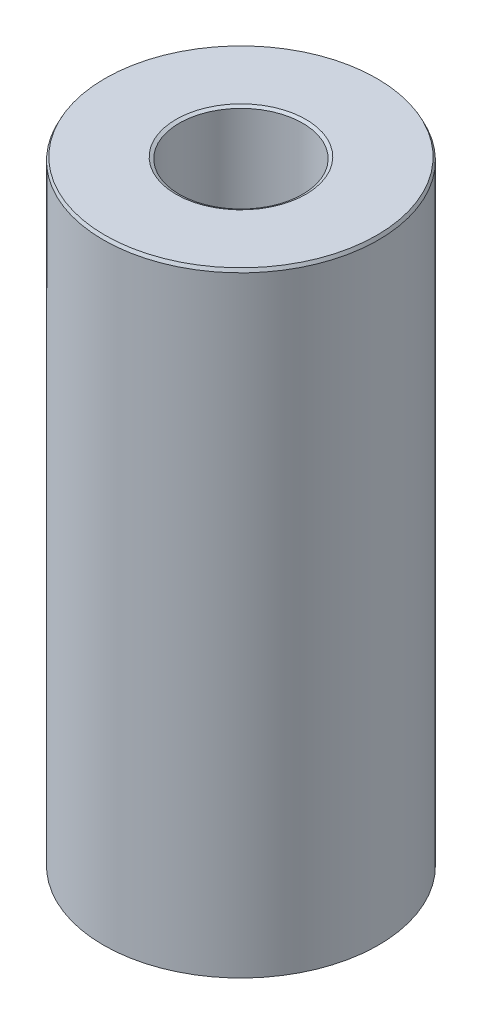
from build123d import *
from OCP.BRepFilletAPI import BRepFilletAPI_MakeChamfer

# Parameters (mm, degrees)
SKETCH1_R           = 12.5
BOSS_EXTRUDE1_DEPTH = 55.955032487
SKETCH2_R           = 5.6073632
CUT_EXTRUDE1_DEPTH  = 59.681050269
CHAMFER1_SIZE       = 0.295286317
CHAMFER1_SIZE2      = 0.147431193


with BuildPart() as part:
    # Sketch1 → Boss-Extrude1 (new body)
    with BuildSketch(Plane(origin=(0, 0, 0), x_dir=(1, 0, 0), z_dir=(0, 1, 0))):
        Circle(SKETCH1_R)
    extrude(amount=BOSS_EXTRUDE1_DEPTH)

    # Sketch2 → Cut-Extrude1 (cut, through all)
    with BuildSketch(Plane(origin=(0, 0, 0), x_dir=(1, 0, 0), z_dir=(0, 1, 0))):
        Circle(SKETCH2_R)
    extrude(amount=CUT_EXTRUDE1_DEPTH, mode=Mode.SUBTRACT)

    # Chamfer1: one chamfer whose edges measure the first distance from different faces: ONE call of the kernel's chamfer builder (chamfer() names one face for all edges)
    chamfer1_edges_1 = [part.edges().sort_by_distance(p)[0] for p in [
        (-5.6073632, 55.955032487, 0),
    ]]
    chamfer1_side_1 = [part.faces().sort_by_distance(p)[0] for p in [
        (-12.146446609, 55.955032487, 0),
    ]]
    chamfer1_edges_2 = [part.edges().sort_by_distance(p)[0] for p in [
        (-5.6073632, 0, 0),
    ]]
    chamfer1_side_2 = [part.faces().sort_by_distance(p)[0] for p in [
        (-5.6073632, 27.977516244, 0),
    ]]
    chamfer1_edges_3 = [part.edges().sort_by_distance(p)[0] for p in [
        (-12.5, 0, 0),
    ]]
    chamfer1_side_3 = [part.faces().sort_by_distance(p)[0] for p in [
        (-12.146446609, 0, 0),
    ]]
    chamfer1_edges_4 = [part.edges().sort_by_distance(p)[0] for p in [
        (-12.5, 55.955032487, 0),
    ]]
    chamfer1_side_4 = [part.faces().sort_by_distance(p)[0] for p in [
        (-12.5, 27.977516244, 0),
    ]]
    chamfer1 = BRepFilletAPI_MakeChamfer(part.part.solid().wrapped)
    for e in chamfer1_edges_1:
        chamfer1.Add(CHAMFER1_SIZE, CHAMFER1_SIZE2, e.wrapped, chamfer1_side_1[0].wrapped)  # the first distance lies on this face
    for e in chamfer1_edges_2:
        chamfer1.Add(CHAMFER1_SIZE, CHAMFER1_SIZE2, e.wrapped, chamfer1_side_2[0].wrapped)  # the first distance lies on this face
    for e in chamfer1_edges_3:
        chamfer1.Add(CHAMFER1_SIZE, CHAMFER1_SIZE2, e.wrapped, chamfer1_side_3[0].wrapped)  # the first distance lies on this face
    for e in chamfer1_edges_4:
        chamfer1.Add(CHAMFER1_SIZE, CHAMFER1_SIZE2, e.wrapped, chamfer1_side_4[0].wrapped)  # the first distance lies on this face
    add(Compound.cast(chamfer1.Shape()), mode=Mode.REPLACE)


solid = part.part
